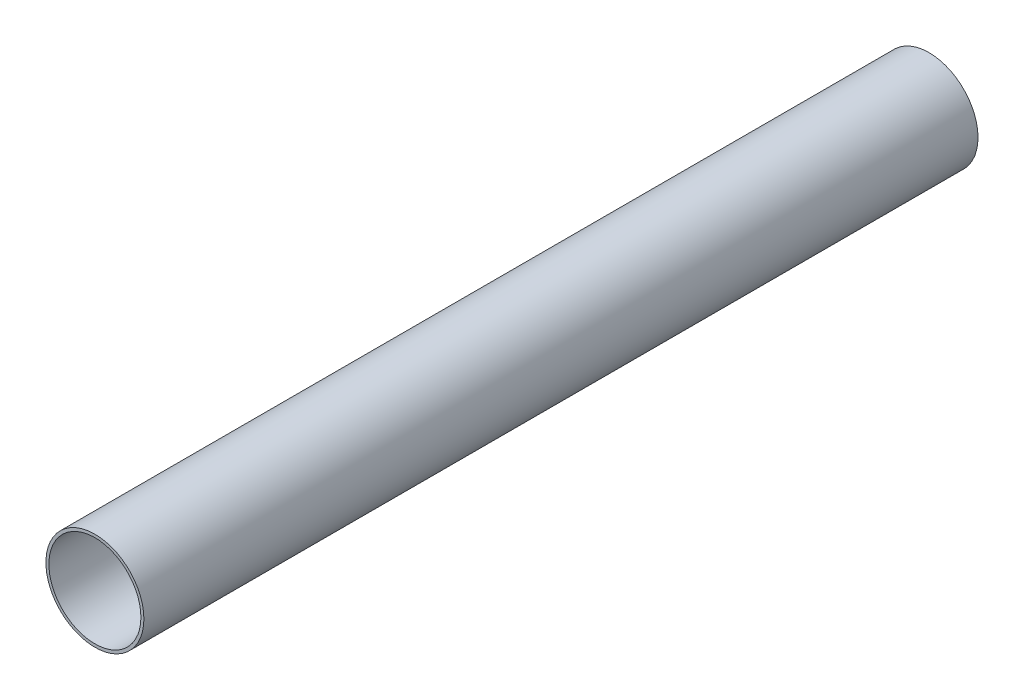
from build123d import *

# Parameters (mm, degrees)
SKETCH1_R           = 20.555
BOSS_EXTRUDE3_DEPTH = 350
CUT_EXTRUDE2_REACH  = 353.205
SKETCH4_R           = 19.305


with BuildPart() as part:
    # Sketch1 → Boss-Extrude3 (new body)
    with BuildSketch(Plane.XY):
        Circle(SKETCH1_R)
    extrude(amount=-BOSS_EXTRUDE3_DEPTH)

    # Sketch4 → Cut-Extrude2 (cut, up to next)
    with BuildSketch(Plane.XY, mode=Mode.PRIVATE) as cut_extrude2_sk1:
        Circle(SKETCH4_R)
    cut_extrude2_tool1 = extrude(cut_extrude2_sk1.sketch, amount=-CUT_EXTRUDE2_REACH, mode=Mode.PRIVATE) & part.part
    add(cut_extrude2_tool1.solids().sort_by_distance((0, 0, 0))[0], mode=Mode.SUBTRACT)


solid = part.part
